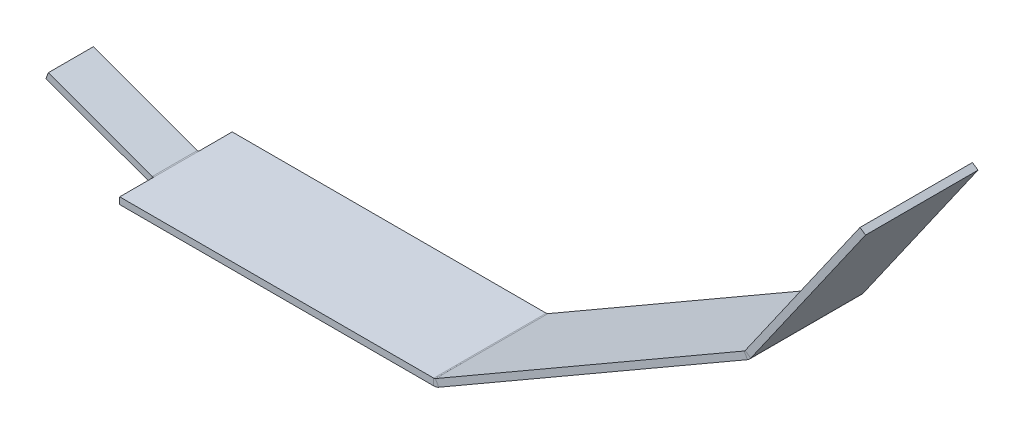
from build123d import *

# Parameters (mm, degrees)
SKETCH1_W                    = 70
SKETCH1_H                    = 25
BASE_FLANGE1_DEPTH           = 1.5
EDGE_FLANGE1_DEPTH           = 10
EDGE_FLANGE2_STRIP_CUT_DEPTH = 25
EDGE_FLANGE2_DEPTH           = 25
EDGE_FLANGE3_STRIP_CUT_DEPTH = 25
EDGE_FLANGE3_DEPTH           = 25


# Sheet-metal steps are written as plain solids
with BuildPart() as part:
    # Sketch1 → Base-Flange1 (new body)
    with BuildSketch(Plane(origin=(0, 0, 0), x_dir=(1, 0, 0), z_dir=(0, 1, 0))):
        Rectangle(SKETCH1_W, SKETCH1_H)
    extrude(amount=-BASE_FLANGE1_DEPTH)

    # Edge-Flange1 section (across the edge) → Edge-Flange1 (add)
    with BuildSketch(Plane(origin=(-35.129882454, 0, -5), x_dir=(0.3420201433256639, 0.9396926207859102, 0), z_dir=(0, 0, 1))):
        with BuildLine():
            Line((-1.5, 0.129882454), (-1.5, 24.735509529))
            Line((-1.5, 24.735509529), (0, 24.735509529))
            Line((0, 24.735509529), (0, 0.129882454))
            ThreePointArc((0, 0.129882454), (0.011190609, 0.001973206), (0.044422416, -0.122049584))
            Line((0.044422416, -0.122049584), (-1.365116516, -0.635079799))
            ThreePointArc((-1.365116516, -0.635079799), (-1.46602102, -0.25849906), (-1.5, 0.129882454))
        make_face()
    extrude(amount=EDGE_FLANGE1_DEPTH)

    # Edge-Flange2 strip (across the edge) → Edge-Flange2 strip cut (cut)
    with BuildSketch(Plane(origin=(35, 0, 12.5), x_dir=(-0.49999999999999495, 0.8660254037844416, 0), z_dir=(0, 0, -1))):
        Polygon((-4.936952418, 5.551052423), (-1.200352418, -0.920928625), (0.098685688, -0.170928625), (-3.637914312, 6.301052423), align=None)
    extrude(amount=EDGE_FLANGE2_STRIP_CUT_DEPTH, mode=Mode.SUBTRACT)

    # Edge-Flange2 section (across the edge) → Edge-Flange2 (add)
    with BuildSketch(Plane(origin=(35, 0, 12.5), x_dir=(-0.49999999999999495, 0.8660254037844416, 0), z_dir=(0, 0, -1))):
        with BuildLine():
            Line((-1.5, 0.197371375), (-1.5, 79.598076211))
            Line((-1.5, 79.598076211), (0, 79.598076211))
            Line((0, 79.598076211), (0, 0.197371375))
            ThreePointArc((0, 0.197371375), (0.025099036, 0.006725267), (0.098685688, -0.170928625))
            Line((0.098685688, -0.170928625), (-1.200352418, -0.920928625))
            ThreePointArc((-1.200352418, -0.920928625), (-1.423789703, -0.381503301), (-1.5, 0.197371375))
        make_face()
    extrude(amount=EDGE_FLANGE2_DEPTH)

    # Edge-Flange3 strip (across the edge) → Edge-Flange3 strip cut (cut)
    with BuildSketch(Plane(origin=(103.933956091, 39.799038106, 12.5), x_dir=(-0.8191520442889849, 0.573576436351056, 0), z_dir=(0, 0, -1))):
        Polygon((-4.44875879, 5.991091638), (-1.290447996, -0.781927716), (0.069013684, -0.148000323), (-3.08929711, 6.625019031), align=None)
    extrude(amount=EDGE_FLANGE3_STRIP_CUT_DEPTH, mode=Mode.SUBTRACT)

    # Edge-Flange3 section (across the edge) → Edge-Flange3 (add)
    with BuildSketch(Plane(origin=(103.933956091, 39.799038106, 12.5), x_dir=(-0.8191520442889849, 0.573576436351056, 0), z_dir=(0, 0, -1))):
        with BuildLine():
            Line((-1.5, 0.163300289), (-1.5, 44.667458006))
            Line((-1.5, 44.667458006), (0, 44.667458006))
            Line((0, 44.667458006), (0, 0.163300289))
            ThreePointArc((0, 0.163300289), (0.017460361, 0.003870869), (0.069013684, -0.148000323))
            Line((0.069013684, -0.148000323), (-1.290447996, -0.781927716))
            ThreePointArc((-1.290447996, -0.781927716), (-1.44698365, -0.320788552), (-1.5, 0.163300289))
        make_face()
    extrude(amount=EDGE_FLANGE3_DEPTH)


solid = part.part
